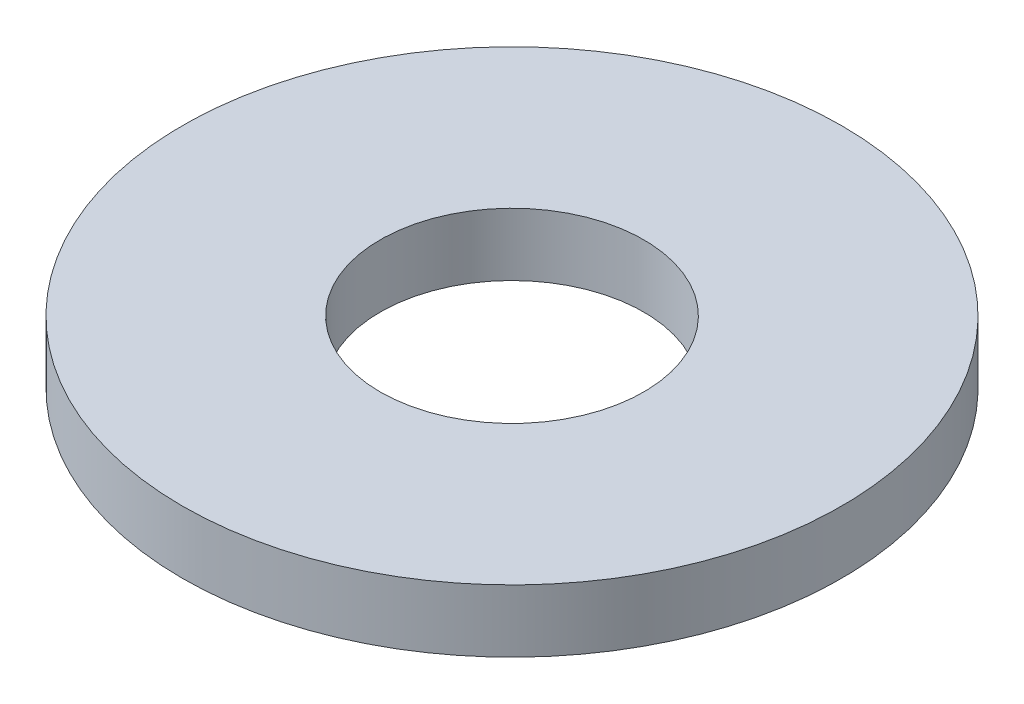
from build123d import *

# Parameters (mm, degrees)
SKETCH1_R           = 100
BOSS_EXTRUDE1_DEPTH = 19
SKETCH2_R           = 40
CUT_EXTRUDE1_DEPTH  = 143.691975948


with BuildPart() as part:
    # Sketch1 → Boss-Extrude1 (new body)
    with BuildSketch(Plane(origin=(0, 0, 0), x_dir=(1, 0, 0), z_dir=(0, 1, 0))):
        Circle(SKETCH1_R)
    extrude(amount=BOSS_EXTRUDE1_DEPTH)

    # Sketch2 → Cut-Extrude1 (cut, through all)
    with BuildSketch(Plane(origin=(0, 0, 0), x_dir=(1, 0, 0), z_dir=(0, 1, 0))):
        Circle(SKETCH2_R)
    extrude(amount=CUT_EXTRUDE1_DEPTH, mode=Mode.SUBTRACT)


solid = part.part
